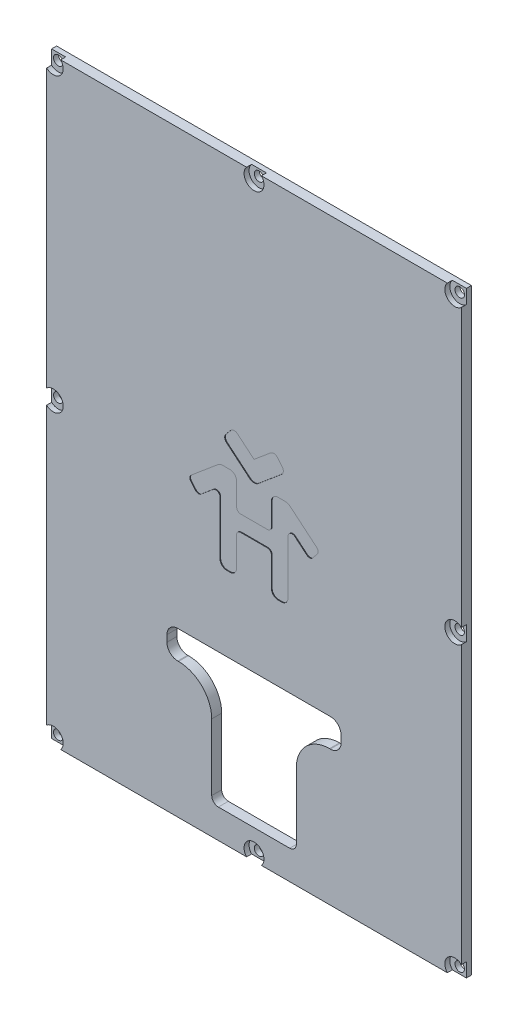
from build123d import *

# Parameters (mm, degrees)
SKETCH_1_W          = 125
SKETCH_1_H          = 180
EXTRUDE_1_DEPTH     = 3
CUT_EXTRUDE_1_DEPTH = 10
SKETCH_3_R          = 3
CUT_EXTRUDE_2_DEPTH = 1.5
SKETCH_4_R          = 1.425
CUT_EXTRUDE_3_DEPTH = 2
CUT_EXTRUDE_4_DEPTH = 0.2


with BuildPart() as part:
    # Эскиз1 → Бобышка-Вытянуть1 (new body)
    with BuildSketch(Plane.XY):
        Rectangle(SKETCH_1_W, SKETCH_1_H)
    extrude(amount=EXTRUDE_1_DEPTH)

    # Эскиз2 → Вырез-Вытянуть1 (cut)
    with BuildSketch(Plane(origin=(0, 0, 0), x_dir=(-1, 0, 0), z_dir=(0, 0, -1))):
        with BuildLine():
            Line((-26.25, -44), (-26.25, -46))
            ThreePointArc((-26.25, -46), (-25.298097039, -48.298097039), (-23, -49.25))
            Line((-23, -49.25), (-22.75, -49.25))
            ThreePointArc((-22.75, -49.25), (-15.678932188, -52.178932188), (-12.75, -59.25))
            Line((-12.75, -59.25), (-12.75, -79.25))
            ThreePointArc((-12.75, -79.25), (-12.164213562, -80.664213562), (-10.75, -81.25))
            Line((-10.75, -81.25), (10.75, -81.25))
            ThreePointArc((10.75, -81.25), (12.164213562, -80.664213562), (12.75, -79.25))
            Line((12.75, -79.25), (12.75, -59.25))
            ThreePointArc((12.75, -59.25), (15.678932188, -52.178932188), (22.75, -49.25))
            Line((22.75, -49.25), (23, -49.25))
            ThreePointArc((23, -49.25), (25.298097039, -48.298097039), (26.25, -46))
            Line((26.25, -46), (26.25, -44))
            ThreePointArc((26.25, -44), (25.298097039, -41.701902961), (23, -40.75))
            Line((23, -40.75), (-23, -40.75))
            ThreePointArc((-23, -40.75), (-25.298097039, -41.701902961), (-26.25, -44))
        make_face()
    extrude(amount=-CUT_EXTRUDE_1_DEPTH, mode=Mode.SUBTRACT)

    # Эскиз3 → Вырез-Вытянуть2 (cut)
    with BuildSketch(Plane.XY.offset(3)):
        with Locations((-60.5, 88)):
            Circle(SKETCH_3_R)
        with Locations((0, 88)):
            Circle(SKETCH_3_R)
        with Locations((60.5, 88)):
            Circle(SKETCH_3_R)
        with Locations((60.5, 0)):
            Circle(SKETCH_3_R)
        with Locations((60.5, -88)):
            Circle(SKETCH_3_R)
        with Locations((0, -88)):
            Circle(SKETCH_3_R)
        with Locations((-60.5, -88)):
            Circle(SKETCH_3_R)
        with Locations((-60.5, 0)):
            Circle(SKETCH_3_R)
    extrude(amount=-CUT_EXTRUDE_2_DEPTH, mode=Mode.SUBTRACT)

    # Эскиз4 → Вырез-Вытянуть3 (cut)
    with BuildSketch(Plane.XY.offset(1.5)):
        with Locations((-60.5, 88)):
            Circle(SKETCH_4_R)
        with Locations((0, 88)):
            Circle(SKETCH_4_R)
        with Locations((60.5, 88)):
            Circle(SKETCH_4_R)
        with Locations((60.5, 0)):
            Circle(SKETCH_4_R)
        with Locations((60.5, -88)):
            Circle(SKETCH_4_R)
        with Locations((0, -88)):
            Circle(SKETCH_4_R)
        with Locations((-60.5, -88)):
            Circle(SKETCH_4_R)
        with Locations((-60.5, 0)):
            Circle(SKETCH_4_R)
    extrude(amount=-CUT_EXTRUDE_3_DEPTH, mode=Mode.SUBTRACT)

    # Эскиз5 → Вырез-Вытянуть4 (cut)
    with BuildSketch(Plane.XY.offset(3)):
        with BuildLine():
            Line((-10.25, -0.09106889), (-10.25, -16.21851864))
            ThreePointArc((-10.25, -16.21851864), (-9.664213562, -17.632732202), (-8.25, -18.21851864))
            Line((-8.25, -18.21851864), (-7.25, -18.21851864))
            ThreePointArc((-7.25, -18.21851864), (-5.835786438, -17.632732202), (-5.25, -16.21851864))
            Line((-5.25, -16.21851864), (-5.25, -7.46851864))
            ThreePointArc((-5.25, -7.46851864), (-4.883883476, -6.584635164), (-4, -6.21851864))
            Line((-4, -6.21851864), (4, -6.21851864))
            ThreePointArc((4, -6.21851864), (4.883883476, -6.584635164), (5.25, -7.46851864))
            Line((5.25, -7.46851864), (5.25, -16.21851864))
            ThreePointArc((5.25, -16.21851864), (5.835786438, -17.632732202), (7.25, -18.21851864))
            Line((7.25, -18.21851864), (8.25, -18.21851864))
            ThreePointArc((8.25, -18.21851864), (9.664213562, -17.632732202), (10.25, -16.21851864))
            Line((10.25, -16.21851864), (10.25, -0.09106889))
            ThreePointArc((10.25, -0.09106889), (10.971727173, 1.041815844), (12.303484512, 0.866486664))
            Line((12.303484512, 0.866486664), (15.917557024, -2.166080248))
            ThreePointArc((15.917557024, -2.166080248), (16.829986215, -2.453768066), (17.67859709, -2.012009206))
            Line((17.67859709, -2.012009206), (19.022071027, -0.410919315))
            ThreePointArc((19.022071027, -0.410919315), (19.309758846, 0.501509876), (18.867999985, 1.350120751))
            Line((18.867999985, 1.350120751), (10.947043439, 7.996592468))
            ThreePointArc((10.947043439, 7.996592468), (10.195124773, 8.430712912), (9.340074414, 8.58148136))
            Line((9.340074414, 8.58148136), (7.25, 8.58148136))
            ThreePointArc((7.25, 8.58148136), (5.835786438, 7.995694922), (5.25, 6.58148136))
            Line((5.25, 6.58148136), (5.25, -0.16851864))
            ThreePointArc((5.25, -0.16851864), (4.883883476, -1.052402116), (4, -1.41851864))
            Line((4, -1.41851864), (-4, -1.41851864))
            ThreePointArc((-4, -1.41851864), (-4.883883476, -1.052402116), (-5.25, -0.16851864))
            Line((-5.25, -0.16851864), (-5.25, 6.58148136))
            ThreePointArc((-5.25, 6.58148136), (-5.835786438, 7.995694922), (-7.25, 8.58148136))
            Line((-7.25, 8.58148136), (-9.340074414, 8.58148136))
            ThreePointArc((-9.340074414, 8.58148136), (-10.195124773, 8.430712912), (-10.947043439, 7.996592468))
            Line((-10.947043439, 7.996592468), (-18.867999985, 1.350120751))
            ThreePointArc((-18.867999985, 1.350120751), (-19.309758846, 0.501509876), (-19.022071027, -0.410919315))
            Line((-19.022071027, -0.410919315), (-17.67859709, -2.012009206))
            ThreePointArc((-17.67859709, -2.012009206), (-16.829986215, -2.453768066), (-15.917557024, -2.166080248))
            Line((-15.917557024, -2.166080248), (-12.303484512, 0.866486664))
            ThreePointArc((-12.303484512, 0.866486664), (-10.971727173, 1.041815844), (-10.25, -0.09106889))
        make_face()
        with BuildLine():
            Line((0, 14.858517807), (-4.979473915, 19.036792532))
            ThreePointArc((-4.979473915, 19.036792532), (-6.074388944, 19.382017915), (-7.092721994, 18.851907282))
            Line((-7.092721994, 18.851907282), (-8.483871936, 17.193999341))
            ThreePointArc((-8.483871936, 17.193999341), (-8.829097318, 16.099084312), (-8.298986686, 15.080751262))
            Line((-8.298986686, 15.080751262), (-1.285575219, 9.195800287))
            ThreePointArc((-1.285575219, 9.195800287), (0, 8.727889173), (1.285575219, 9.195800287))
            Line((1.285575219, 9.195800287), (8.298986686, 15.080751262))
            ThreePointArc((8.298986686, 15.080751262), (8.829097318, 16.099084312), (8.483871936, 17.193999341))
            Line((8.483871936, 17.193999341), (7.092721994, 18.851907282))
            ThreePointArc((7.092721994, 18.851907282), (6.074388944, 19.382017915), (4.979473915, 19.036792532))
            Line((4.979473915, 19.036792532), (0, 14.858517807))
        make_face()
    extrude(amount=-CUT_EXTRUDE_4_DEPTH, mode=Mode.SUBTRACT)


solid = part.part
